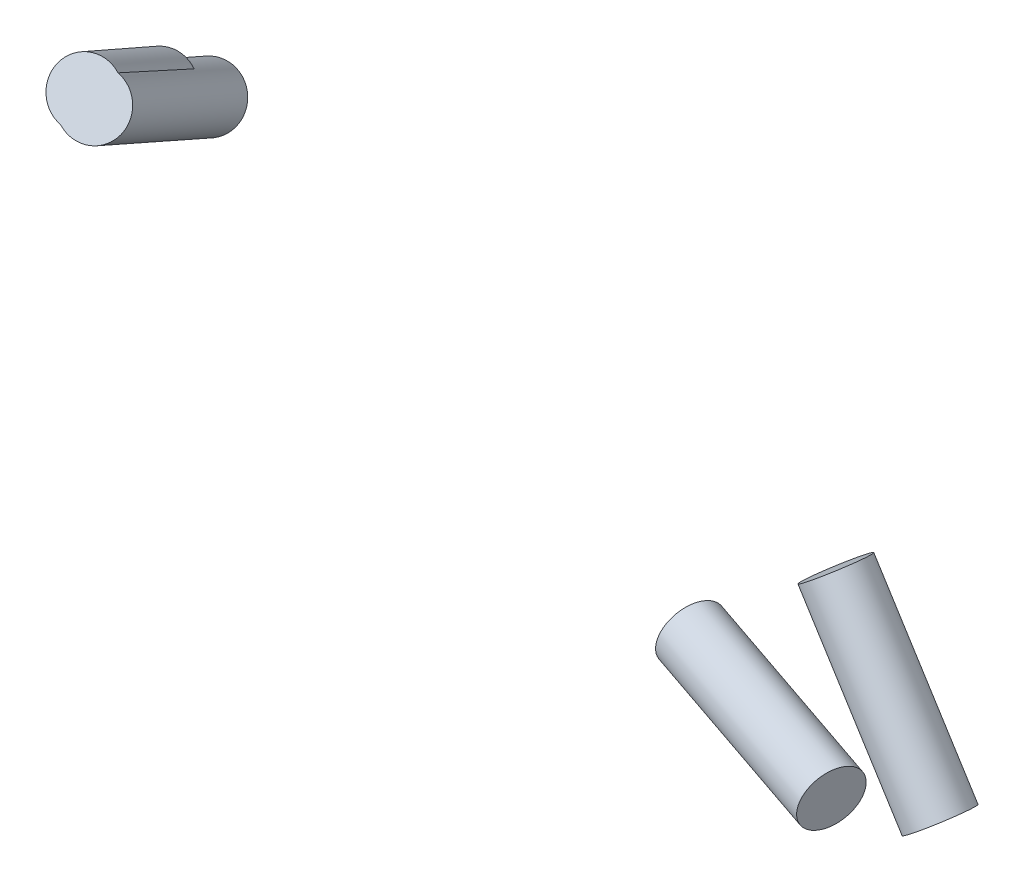
from build123d import *

# Parameters (mm, degrees)
SUSP_FR_ROCKER_BRACKET_A_PROFILE_R     = 7
SUSP_FR_ROCKER_BRACKET_B_PROFILE_R     = 7
SUSP_FR_COILOVER_BRACKET_A_PROFILE_R   = 7
SUSP_FR_COILOVER_BRACKET_B_START       = -153.343858877
SUSP_FR_COILOVER_BRACKET_B_OUTLINE_R   = 7
SUSP_FR_COILOVER_BRACKET_B_DEPTH       = 56.748118524
SUSP_FR_COILOVER_BRACKET_B_START_2     = -96.439698882
SUSP_FR_COILOVER_BRACKET_B_2_OUTLINE_W = 17
SUSP_FR_COILOVER_BRACKET_B_2_OUTLINE_H = 17
SUSP_FR_COILOVER_BRACKET_B_2_DEPTH     = 1.439698882


with BuildPart() as part:
    # SUSP_FR_rocker_bracket_a: sweep along a curve in space
    with BuildLine() as susp_fr_rocker_bracket_a_path:
        Line((210.980497, -238.523155, -67.7546604), (254.500188, -246.605638, -58.2344508))
    # SUSP_FR_rocker_bracket_a profile (on start of the path) → SUSP_FR_rocker_bracket_a (sweep)
    with BuildSketch(Plane(origin=(210.980497, -238.523155, -67.7546604), x_dir=(-0.21370281690009318, 0, 0.9768987184191438), z_dir=(0.9612068958359004, -0.17851547693839223, 0.2102701307627194))):
        Circle(SUSP_FR_ROCKER_BRACKET_A_PROFILE_R)
    sweep(path=susp_fr_rocker_bracket_a_path.line)


with BuildPart() as body_2:
    # SUSP_FR_rocker_bracket_b: sweep along a curve in space
    with BuildLine() as susp_fr_rocker_bracket_b_path:
        Line((217.671213, -235.931172, -96.1393535), (246.179812, -272.574362, -92.7655492))
    # SUSP_FR_rocker_bracket_b profile (on start of the path) → SUSP_FR_rocker_bracket_b (sweep)
    with BuildSketch(Plane(origin=(217.671213, -235.931172, -96.1393535), x_dir=(-0.7892651534447245, -0.614052536480288, 0), z_dir=(0.6124375878865993, -0.7871893984011755, 0.07247794139211926))):
        Circle(SUSP_FR_ROCKER_BRACKET_B_PROFILE_R)
    sweep(path=susp_fr_rocker_bracket_b_path.line)


with BuildPart() as body_3:
    # SUSP_FR_coilover_bracket_a: sweep along a curve in space
    with BuildLine() as susp_fr_coilover_bracket_a_path:
        Line((90.2859184, -173.45527, -42.383), (79.0072944, -192.655717, -71.8225231))
    # SUSP_FR_coilover_bracket_a profile (on start of the path) → SUSP_FR_coilover_bracket_a (sweep)
    with BuildSketch(Plane(origin=(90.2859184, -173.45527, -42.383), x_dir=(0, -0.8376007285532237, 0.546282911619162), z_dir=(-0.3055483110770024, -0.5201577916573424, -0.7975437927638508))):
        Circle(SUSP_FR_COILOVER_BRACKET_A_PROFILE_R)
    sweep(path=susp_fr_coilover_bracket_a_path.line)

    # SUSP_FR_coilover_bracket_b: read off the stored shape, not the designer's step
    # SUSP_FR_coilover_bracket_b outline → SUSP_FR_coilover_bracket_b (add)
    with BuildSketch(Plane(origin=(0, 0, 0), x_dir=(0.9517732897377809, -0.16835993398862525, -0.2564810666873248), z_dir=(0.30680222447322997, 0.5222924589530519, 0.7956651194937808)).offset(SUSP_FR_COILOVER_BRACKET_B_START)):
        with Locations((128.467087626, -122.898172142)):
            Circle(SUSP_FR_COILOVER_BRACKET_B_OUTLINE_R)
    extrude(amount=SUSP_FR_COILOVER_BRACKET_B_DEPTH)

    # SUSP_FR_coilover_bracket_b 2 outline → SUSP_FR_coilover_bracket_b 2 (cut)
    with BuildSketch(Plane(origin=(0, 0, 0), x_dir=(0.9521765748000688, -0.16691582101546293, -0.25592748796630466), z_dir=(0.3055483110770031, 0.5201577916573431, 0.7975437927638501)).offset(SUSP_FR_COILOVER_BRACKET_B_START_2)):
        with Locations((128.5, -123.5)):
            Rectangle(SUSP_FR_COILOVER_BRACKET_B_2_OUTLINE_W, SUSP_FR_COILOVER_BRACKET_B_2_OUTLINE_H)
    extrude(amount=SUSP_FR_COILOVER_BRACKET_B_2_DEPTH, mode=Mode.SUBTRACT)


solid = Compound([part.part, body_2.part, body_3.part])
